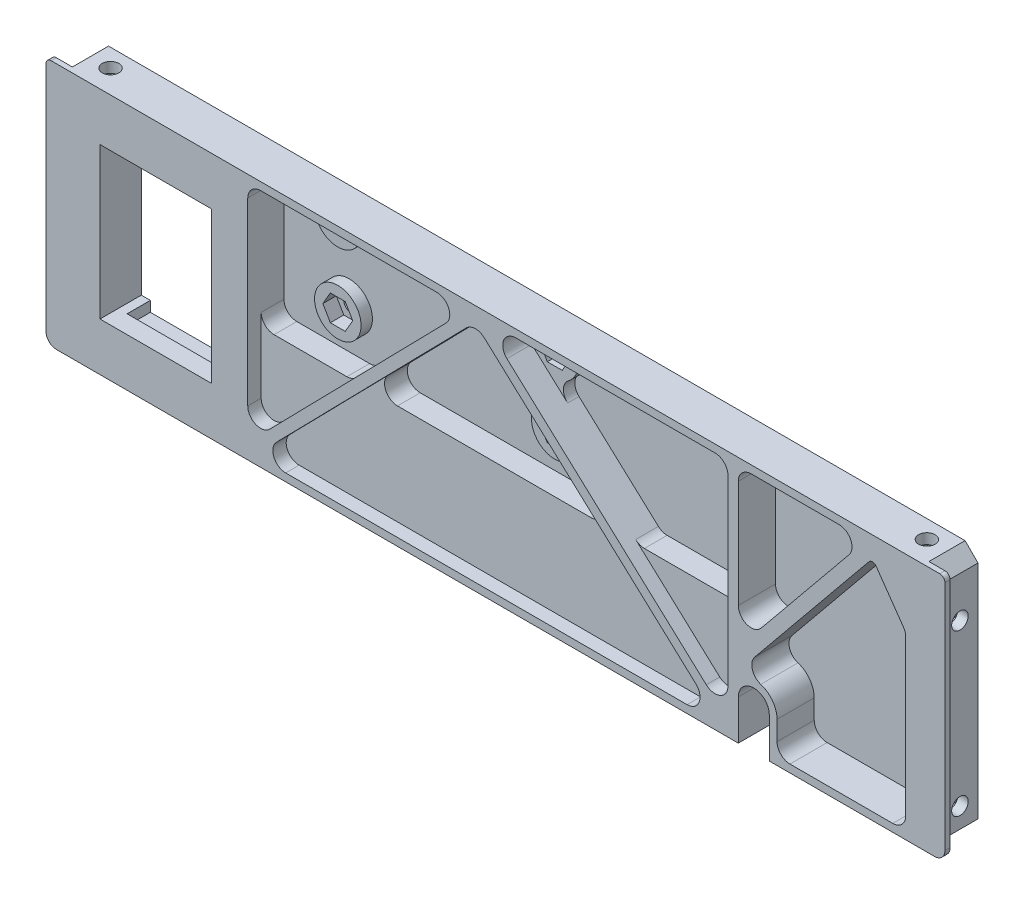
from build123d import *

# Parameters (mm, degrees)
SKETCH1_W                 = 174
SKETCH1_H                 = 51.1
BOSS_EXTRUDE1_DEPTH       = 8
SKETCH2_OUTSIDE_W         = 212.304
SKETCH2_OUTSIDE_H         = 89.404
SKETCH2_OUTSIDE_W_2       = 170.8
SKETCH2_OUTSIDE_H_2       = 47.9
CUT_EXTRUDE1_DEPTH        = 7
CHAMFER1_SIZE             = 2.5
FILLET1_R                 = 0.5
SKETCH3_W                 = 158.8
SKETCH3_H                 = 44.9
CUT_EXTRUDE2_DEPTH        = 7.2
BOSS_EXTRUDE2_DEPTH       = 7.2
F_3_0MM_DOWEL_HOLE1_D     = 3.2
F_3_0MM_DOWEL_HOLE1_DEPTH = 5
F_3_0MM_DOWEL_HOLE2_D     = 3.2
F_3_0MM_DOWEL_HOLE2_DEPTH = 5
CUT_EXTRUDE3_START        = -2
SKETCH10_W                = 6.25
SKETCH10_H                = 5.5
CUT_EXTRUDE3_DEPTH        = 1.8
CUT_EXTRUDE4_START        = -2
SKETCH11_W                = 5.5
SKETCH11_H                = 6.25
CUT_EXTRUDE4_DEPTH        = 1.8
BOSS_EXTRUDE3_DEPTH       = 7.2
SMALL_FIX_DEPTH           = 7.2
SKETCH14_W                = 174
SKETCH14_H                = 1.6
CUT_EXTRUDE5_DEPTH        = 91.94395252
FILLET2_R                 = 2.5
FILLET3_R                 = 1
FILLET4_R                 = 2
SKETCH23_W                = 174
SKETCH23_H                = 1.6
CUT_EXTRUDE9_DEPTH        = 91.94395252
BOSS_EXTRUDE7_START       = -7.2
BOSS_EXTRUDE7_DEPTH       = 7.2
SKETCH26_W                = 21.6
SKETCH26_H                = 29.25
CUT_EXTRUDE10_DEPTH       = 8
FILLET5_R                 = 1
CUT_EXTRUDE15_DEPTH       = 91.52316002
CUT_EXTRUDE15_DEPTH_BACK  = 91.52316002
BOSS_EXTRUDE12_DEPTH      = 7.2
SKETCH38_W                = 96.95
SKETCH38_H                = 46.4
BOSS_EXTRUDE13_DEPTH      = 8
SKETCH40_W                = 33
SKETCH40_H                = 18.02
SKETCH40_W_2              = 43.4
SKETCH40_H_2              = 17.6
CUT_EXTRUDE16_DEPTH       = 2
SKETCH42_W                = 7
SKETCH42_H                = 17.6
SKETCH42_W_2              = 28.4
CUT_EXTRUDE17_DEPTH       = 2.4
SKETCH43_W                = 92.95
SKETCH43_H                = 44.9
CUT_EXTRUDE18_DEPTH       = 2.6
SKETCH44_W                = 92.95
SKETCH44_H                = 25.45
CUT_EXTRUDE19_DEPTH       = 4.4
SKETCH45_R                = 1.45
CUT_EXTRUDE20_DEPTH       = 91.590300253
SKETCH46_R                = 4.5
SKETCH46_R_2              = 1.45
BOSS_EXTRUDE14_DEPTH      = 2.2
CUT_EXTRUDE21_DEPTH       = 2.6
BOSS_EXTRUDE15_REACH      = 92.59
BOSS_EXTRUDE16_START      = -2.2
BOSS_EXTRUDE16_DEPTH      = 2.2
FILLET6_R                 = 2.5
SKETCH50_W                = 18.1
SKETCH50_H                = 2
CUT_EXTRUDE22_DEPTH       = 4.5


with BuildPart() as part:
    # Sketch1 → Boss-Extrude1 (new body)
    with BuildSketch(Plane.XY):
        Rectangle(SKETCH1_W, SKETCH1_H)
    extrude(amount=-BOSS_EXTRUDE1_DEPTH)

    # Sketch2 outside → Cut-Extrude1 (cut)
    with BuildSketch(Plane(origin=(0, 0, -8), x_dir=(-1, 0, 0), z_dir=(0, 0, -1))):
        Rectangle(SKETCH2_OUTSIDE_W, SKETCH2_OUTSIDE_H)
        Rectangle(SKETCH2_OUTSIDE_W_2, SKETCH2_OUTSIDE_H_2, mode=Mode.SUBTRACT)
    extrude(amount=-CUT_EXTRUDE1_DEPTH, mode=Mode.SUBTRACT)

    # Chamfer1
    chamfer1_edges = [part.edges().sort_by_distance(p)[0] for p in [
        (85.4, -23.95, -4.5),
        (85.4, 23.95, -4.5),
        (-85.4, 23.95, -4.5),
        (-85.4, -23.95, -4.5),
    ]]
    chamfer(chamfer1_edges, length=CHAMFER1_SIZE)

    # Fillet1
    fillet1_edges = [part.edges().sort_by_distance(p)[0] for p in [
        (87, 25.55, -0.5),
        (-87, 25.55, -0.5),
    ]]
    fillet(fillet1_edges, radius=FILLET1_R)

    # Sketch3 → Cut-Extrude2 (cut)
    with BuildSketch(Plane.XY):
        Rectangle(SKETCH3_W, SKETCH3_H)
    extrude(amount=-CUT_EXTRUDE2_DEPTH, mode=Mode.SUBTRACT)

    # Sketch9 → Boss-Extrude2 (add)
    with BuildSketch(Plane.XY):
        Polygon((-73.4, 22.45), (-73.4, 19.45), (-79.4, 10.88111196), (-79.4, 22.45), align=None)
    boss_extrude2 = extrude(amount=-BOSS_EXTRUDE2_DEPTH)

    # Ø3.0mm Dowel Hole1
    with Locations(Plane.ZY.offset(85.4)):
        with Locations((-4.5, 13.55), (-4.5, -17.55)):
            f_3_0mm_dowel_hole1 = Hole(F_3_0MM_DOWEL_HOLE1_D / 2, depth=F_3_0MM_DOWEL_HOLE1_DEPTH)

    # Ø3.0mm Dowel Hole2
    with Locations(Plane(origin=(0, 23.95, 0), x_dir=(1, 0, 0), z_dir=(0, 1, 0))):
        with Locations((-79, 4.5)):
            f_3_0mm_dowel_hole2 = Hole(F_3_0MM_DOWEL_HOLE2_D / 2, depth=F_3_0MM_DOWEL_HOLE2_DEPTH)

    # Sketch10 → Cut-Extrude3 (cut)
    with BuildSketch(Plane.ZY.offset(85.4).offset(CUT_EXTRUDE3_START)):
        with Locations((-4.875, 13.55)):
            Rectangle(SKETCH10_W, SKETCH10_H)
        with Locations((-4.875, -17.55)):
            Rectangle(SKETCH10_W, SKETCH10_H)
    cut_extrude3 = extrude(amount=-CUT_EXTRUDE3_DEPTH, mode=Mode.SUBTRACT)

    # Sketch11 → Cut-Extrude4 (cut)
    with BuildSketch(Plane(origin=(0, 23.95, 0), x_dir=(1, 0, 0), z_dir=(0, 1, 0)).offset(CUT_EXTRUDE4_START)):
        with Locations((-79, 4.875)):
            Rectangle(SKETCH11_W, SKETCH11_H)
    cut_extrude4 = extrude(amount=-CUT_EXTRUDE4_DEPTH, mode=Mode.SUBTRACT)

    # Mirror1: Boss-Extrude2, Ø3.0mm Dowel Hole1, Ø3.0mm Dowel Hole2, Cut-Extrude3, Cut-Extrude4 across plane
    add(boss_extrude2.mirror(Plane(origin=(0, 0, 0), x_dir=(0, 0, 1), z_dir=(1, 0, 0))))
    add(f_3_0mm_dowel_hole1.mirror(Plane(origin=(0, 0, 0), x_dir=(0, 0, 1), z_dir=(1, 0, 0))), mode=Mode.SUBTRACT)
    add(f_3_0mm_dowel_hole2.mirror(Plane(origin=(0, 0, 0), x_dir=(0, 0, 1), z_dir=(1, 0, 0))), mode=Mode.SUBTRACT)
    add(cut_extrude3.mirror(Plane(origin=(0, 0, 0), x_dir=(0, 0, 1), z_dir=(1, 0, 0))), mode=Mode.SUBTRACT)
    add(cut_extrude4.mirror(Plane(origin=(0, 0, 0), x_dir=(0, 0, 1), z_dir=(1, 0, 0))), mode=Mode.SUBTRACT)

    # Sketch12 → Boss-Extrude3 (add)
    with BuildSketch(Plane.XY.offset(-7.2)):
        with BuildLine():
            Line((-74.367830663, 21.658922376), (-37.47426453, -23.477892866))
            ThreePointArc((-37.47426453, -23.477892866), (-36.7, -23.845030766), (-35.92573547, -23.477892866))
            Line((-35.92573547, -23.477892866), (0, 20.474846169))
            Line((0, 20.474846169), (35.92573547, -23.477892866))
            ThreePointArc((35.92573547, -23.477892866), (36.7, -23.845030766), (37.47426453, -23.477892866))
            Line((37.47426453, -23.477892866), (74.367830663, 21.658922376))
            ThreePointArc((74.367830663, 21.658922376), (74.191077624, 23.417830663), (72.432169337, 23.241077624))
            Line((72.432169337, 23.241077624), (36.7, -20.474846169))
            Line((36.7, -20.474846169), (0.77426453, 23.477892866))
            ThreePointArc((0.77426453, 23.477892866), (0, 23.845030766), (-0.77426453, 23.477892866))
            Line((-0.77426453, 23.477892866), (-36.7, -20.474846169))
            Line((-36.7, -20.474846169), (-72.432169337, 23.241077624))
            ThreePointArc((-72.432169337, 23.241077624), (-74.191077624, 23.417830663), (-74.367830663, 21.658922376))
        make_face()
    extrude(amount=BOSS_EXTRUDE3_DEPTH)

    # Sketch13 → Small Fix (add)
    with BuildSketch(Plane.XY):
        Polygon((-73.4, 19.45), (-73.4, 20.474846169), (-72.562319501, 19.45), align=None)
        Polygon((72.562319501, 19.45), (73.4, 19.45), (73.4, 20.474846169), align=None)
    extrude(amount=-SMALL_FIX_DEPTH)

    # Sketch14 → Cut-Extrude5 (cut, through all)
    with BuildSketch(Plane(origin=(0, 0, -1), x_dir=(-1, 0, 0), z_dir=(0, 0, -1))):
        with Locations((0, -24.75)):
            Rectangle(SKETCH14_W, SKETCH14_H)
    extrude(amount=-CUT_EXTRUDE5_DEPTH, mode=Mode.SUBTRACT)

    # Fillet2
    fillet2_edges = [part.edges().sort_by_distance(p)[0] for p in [
        (-79.4, 10.88111196, -3.6),
        (79.4, 10.88111196, -3.6),
        (35.085564686, -22.45, -3.6),
        (-35.085564686, -22.45, -3.6),
        (71.785564686, 22.45, -3.6),
        (1.614435314, 22.45, -3.6),
        (36.7, -20.474846169, -3.6),
        (-1.614435314, 22.45, -3.6),
        (-71.785564686, 22.45, -3.6),
        (-36.7, -20.474846169, -3.6),
        (0, 20.474846169, -3.6),
        (-38.314435314, -22.45, -3.6),
        (38.314435314, -22.45, -3.6),
        (-79.4, -22.45, -3.6),
        (79.4, -22.45, -3.6),
    ]]
    fillet(fillet2_edges, radius=FILLET2_R)

    # Fillet3
    # the kernel refuses this fillet: 1 mm, written as the material it adds along each edge
    with BuildSketch(Plane(origin=(73.4, 19.45, 0), x_dir=(-1, 0, 0), z_dir=(0, 0, -1))) as fillet3_piece_1_section:
        with BuildLine():
            CenterArc((FILLET3_R * 0.520567050552, -FILLET3_R), FILLET3_R, 90, 55)
            Line((-FILLET3_R * 0.298584993737, -FILLET3_R * 0.426423563649), (0, 0))
            Line((0, 0), (FILLET3_R * 0.520567050552, 0))
        make_face()
    fillet3_piece_1 = extrude(amount=8.501417626, mode=Mode.PRIVATE)
    fillet3_piece_1 = split(fillet3_piece_1, bisect_by=Plane(origin=(73.353785403, 19.361222585, -8), z_dir=(0, 0, 1)), keep=Keep.TOP, mode=Mode.PRIVATE)
    add(fillet3_piece_1)
    with BuildSketch(Plane(origin=(72.562319501, 19.45, 0), x_dir=(-0.6328620994689726, -0.7742645304130392, 0), z_dir=(0, 0, -1))) as fillet3_piece_2_section:
        with BuildLine():
            CenterArc((FILLET3_R * 0.474176313275, -FILLET3_R), FILLET3_R, 90, 50.738399871)
            Line((-FILLET3_R * 0.300088217138, -FILLET3_R * 0.367137900531), (0, 0))
            Line((0, 0), (FILLET3_R * 0.474176313275, 0))
        make_face()
    fillet3_piece_2 = extrude(amount=8.385440783, mode=Mode.PRIVATE)
    fillet3_piece_2 = split(fillet3_piece_2, bisect_by=Plane(origin=(72.598343981, 19.374027247, -8), z_dir=(0, 0, 1)), keep=Keep.TOP, mode=Mode.PRIVATE)
    add(fillet3_piece_2)
    with BuildSketch(Plane(origin=(-72.562319501, 19.45, 0), x_dir=(0.6328620994689873, -0.7742645304130272, 0), z_dir=(0, 0, -1))) as fillet3_piece_3:
        with BuildLine():
            CenterArc((FILLET3_R * 0.474176313275, FILLET3_R), FILLET3_R, 219.261600129, 50.738399871)
            Line((-FILLET3_R * 0.300088217138, FILLET3_R * 0.367137900531), (0, 0))
            Line((0, 0), (FILLET3_R * 0.474176313275, 0))
        make_face()
    extrude(amount=7.2)
    with BuildSketch(Plane(origin=(-73.4, 19.45, 0), x_dir=(1, 0, 0), z_dir=(0, 0, -1))) as fillet3_piece_4:
        with BuildLine():
            CenterArc((FILLET3_R * 0.520567050552, FILLET3_R), FILLET3_R, 215, 55)
            Line((-FILLET3_R * 0.298584993737, FILLET3_R * 0.426423563649), (0, 0))
            Line((0, 0), (FILLET3_R * 0.520567050552, 0))
        make_face()
    extrude(amount=7.2)

    # Fillet4
    fillet4_edges = [part.edges().sort_by_distance(p)[0] for p in [
        (87, -23.95, -0.5),
        (-87, -23.95, -0.5),
    ]]
    fillet(fillet4_edges, radius=FILLET4_R)

    # Sketch23 → Cut-Extrude9 (cut, through all)
    with BuildSketch(Plane(origin=(0, 0, -1), x_dir=(-1, 0, 0), z_dir=(0, 0, -1))):
        with Locations((0, 24.75)):
            Rectangle(SKETCH23_W, SKETCH23_H)
    extrude(amount=-CUT_EXTRUDE9_DEPTH, mode=Mode.SUBTRACT)

    # Sketch24 → Boss-Extrude7 (add)
    with BuildSketch(Plane.XY.offset(BOSS_EXTRUDE7_START)):
        with BuildLine():
            Line((-73.698584994, 19.023576436), (-73.698584994, 22.45))
            Line((-73.698584994, 22.45), (-49.95, 22.45))
            Line((-49.95, 22.45), (-49.95, -22.45))
            Line((-49.95, -22.45), (-79.4, -22.45))
            Line((-79.4, -22.45), (-79.4, 10.092864987))
            ThreePointArc((-79.4, 10.092864987), (-79.284292377, 10.844629486), (-78.947880111, 11.526806078))
            Line((-78.947880111, 11.526806078), (-73.698584994, 19.023576436))
        make_face()
    extrude(amount=BOSS_EXTRUDE7_DEPTH)

    # Sketch26 → Cut-Extrude10 (cut)
    with BuildSketch(Plane.XY):
        with Locations((-65.75, 0)):
            Rectangle(SKETCH26_W, SKETCH26_H)
    extrude(amount=-CUT_EXTRUDE10_DEPTH, mode=Mode.SUBTRACT)

    # Fillet5
    fillet5_edges = [part.edges().sort_by_distance(p)[0] for p in [
        (87, 23.95, -0.5),
        (-87, 23.95, -0.5),
    ]]
    fillet(fillet5_edges, radius=FILLET5_R)

    # Sketch35 → Cut-Extrude15 (cut, two sides: drawn at the far end of the back side and taken through both)
    with BuildSketch(Plane.XY.offset(-7.2).offset(-CUT_EXTRUDE15_DEPTH_BACK)):
        with BuildLine():
            Line((47, -16.2), (47, -23.95))
            Line((47, -23.95), (53, -23.95))
            Line((53, -23.95), (53, -16.2))
            ThreePointArc((53, -16.2), (50, -13.2), (47, -16.2))
        make_face()
    extrude(amount=CUT_EXTRUDE15_DEPTH + CUT_EXTRUDE15_DEPTH_BACK, mode=Mode.SUBTRACT)

    # Sketch37 → Boss-Extrude12 (add)
    with BuildSketch(Plane.XY):
        with BuildLine():
            Line((47, -16.2), (47, -22.45))
            Line((47, -22.45), (43.586735785, -22.45))
            ThreePointArc((43.586735785, -22.45), (41.327821431, -21.021123681), (41.651074459, -18.367844751))
            Line((41.651074459, -18.367844751), (47.101183643, -11.7))
            Line((47.101183643, -11.7), (50, -11.7))
            ThreePointArc((50, -11.7), (53.181980515, -13.018019485), (54.5, -16.2))
            Line((54.5, -16.2), (54.5, -22.45))
            Line((54.5, -22.45), (53, -22.45))
            Line((53, -22.45), (53, -16.2))
            ThreePointArc((53, -16.2), (50, -13.2), (47, -16.2))
        make_face()
    extrude(amount=-BOSS_EXTRUDE12_DEPTH)

    # Sketch38 → Boss-Extrude13 (add)
    with BuildSketch(Plane.XY):
        with Locations((-1.475, -0.75)):
            Rectangle(SKETCH38_W, SKETCH38_H)
    extrude(amount=-BOSS_EXTRUDE13_DEPTH)

    # Sketch40 → Cut-Extrude16 (cut)
    with BuildSketch(Plane(origin=(0, 0, -8), x_dir=(-1, 0, 0), z_dir=(0, 0, -1))):
        with Locations((-19, -14.01)):
            Rectangle(SKETCH40_W, SKETCH40_H)
        with Locations((29.4, -13.8)):
            Rectangle(SKETCH40_W_2, SKETCH40_H_2)
    extrude(amount=-CUT_EXTRUDE16_DEPTH, mode=Mode.SUBTRACT)

    # Sketch42 → Cut-Extrude17 (cut)
    with BuildSketch(Plane(origin=(0, 0, -6), x_dir=(-1, 0, 0), z_dir=(0, 0, -1))):
        with Locations((11.2, -13.8)):
            Rectangle(SKETCH42_W, SKETCH42_H)
        with Locations((33.9, -13.8)):
            Rectangle(SKETCH42_W_2, SKETCH42_H)
    extrude(amount=-CUT_EXTRUDE17_DEPTH, mode=Mode.SUBTRACT)

    # Sketch43 → Cut-Extrude18 (cut)
    with BuildSketch(Plane.XY):
        with Locations((-1.475, 0)):
            Rectangle(SKETCH43_W, SKETCH43_H)
    extrude(amount=-CUT_EXTRUDE18_DEPTH, mode=Mode.SUBTRACT)

    # Sketch44 → Cut-Extrude19 (cut)
    with BuildSketch(Plane.XY.offset(-2.6)):
        with Locations((-1.475, 9.725)):
            Rectangle(SKETCH44_W, SKETCH44_H)
    extrude(amount=-CUT_EXTRUDE19_DEPTH, mode=Mode.SUBTRACT)

    # Sketch45 → Cut-Extrude20 (cut, through all)
    with BuildSketch(Plane(origin=(0, 0, -8), x_dir=(-1, 0, 0), z_dir=(0, 0, -1))):
        with Locations((-6.68, 19.2)):
            Circle(SKETCH45_R)
        with Locations((-6.68, 5.6)):
            Circle(SKETCH45_R)
        with Locations((35.32, 20.16)):
            Circle(SKETCH45_R)
        with Locations((35.32, 4.74)):
            Circle(SKETCH45_R)
    extrude(amount=-CUT_EXTRUDE20_DEPTH, mode=Mode.SUBTRACT)

    # Sketch46 → Boss-Extrude14 (add)
    # profile 1 of 4: a face of its own
    with BuildSketch(Plane.XY.offset(-7)):
        with Locations((-35.32, 4.74)):
            Circle(SKETCH46_R)
        with Locations(Location((-35.32, 4.74, 0), (0, 0, 180))):
            Circle(SKETCH46_R_2, mode=Mode.SUBTRACT)
    # profile 2 of 4: a face of its own
    with BuildSketch(Plane.XY.offset(-7)):
        with Locations((6.68, 5.6)):
            Circle(SKETCH46_R)
        with Locations(Location((6.68, 5.6, 0), (0, 0, 180))):
            Circle(SKETCH46_R_2, mode=Mode.SUBTRACT)
    # profile 3 of 4: a face of its own
    with BuildSketch(Plane.XY.offset(-7)):
        with BuildLine():
            Line((-30.82, 23.95), (-30.82, 20.16))
            ThreePointArc((-30.82, 20.16), (-35.32, 15.66), (-39.82, 20.16))
            Line((-39.82, 20.16), (-39.82, 23.95))
            Line((-39.82, 23.95), (-30.82, 23.95))
        make_face()
        with Locations(Location((-35.32, 20.16, 0), (0, 0, 180))):
            Circle(SKETCH46_R_2, mode=Mode.SUBTRACT)
    # profile 4 of 4: a face of its own
    with BuildSketch(Plane.XY.offset(-7)):
        with BuildLine():
            Line((2.18, 23.95), (11.18, 23.95))
            Line((11.18, 23.95), (11.18, 19.2))
            ThreePointArc((11.18, 19.2), (6.68, 14.7), (2.18, 19.2))
            Line((2.18, 19.2), (2.18, 23.95))
        make_face()
        with Locations(Location((6.68, 19.2, 0), (0, 0, 180))):
            Circle(SKETCH46_R_2, mode=Mode.SUBTRACT)
    extrude(amount=BOSS_EXTRUDE14_DEPTH)

    # Sketch47 → Cut-Extrude21 (cut)
    with BuildSketch(Plane.XY.offset(-4.8)):
        Polygon((-32.433248654, 20.16), (-33.876624327, 22.66), (-36.763375673, 22.66), (-38.206751346, 20.16), (-36.763375673, 17.66), (-33.876624327, 17.66), align=None)
        Polygon((-32.433248654, 4.74), (-33.876624327, 7.24), (-36.763375673, 7.24), (-38.206751346, 4.74), (-36.763375673, 2.24), (-33.876624327, 2.24), align=None)
        Polygon((9.566751346, 5.6), (8.123375673, 8.1), (5.236624327, 8.1), (3.793248654, 5.6), (5.236624327, 3.1), (8.123375673, 3.1), align=None)
        Polygon((3.793248654, 19.2), (5.236624327, 16.7), (8.123375673, 16.7), (9.566751346, 19.2), (8.123375673, 21.7), (5.236624327, 21.7), align=None)
    extrude(amount=-CUT_EXTRUDE21_DEPTH, mode=Mode.SUBTRACT)

    # Sketch48 → Boss-Extrude15 (add, up to next)
    with BuildSketch(Plane.XY, mode=Mode.PRIVATE) as boss_extrude15_sk1:
        Polygon((-47.235373555, -23.149506286), (-3.962206737, 21.059030463), (44.324411653, -23.187279042), (45.675588347, -21.712720958), (-4.037793263, 23.840969537), (-48.664626445, -21.750493714), align=None)
    boss_extrude15_tool1 = extrude(boss_extrude15_sk1.sketch, amount=-BOSS_EXTRUDE15_REACH, mode=Mode.PRIVATE) - part.part
    add(boss_extrude15_tool1.solids().sort_by_distance((-26.352094, -0.307873, 0))[0])

    # Sketch49 → Boss-Extrude16 (add)
    with BuildSketch(Plane.XY.offset(-4.8).offset(BOSS_EXTRUDE16_START)):
        with BuildLine():
            Line((-2.51980869, 22.45), (2.18, 22.45))
            Line((2.18, 22.45), (2.18, 19.2))
            ThreePointArc((2.18, 19.2), (2.221475714, 18.590441807), (2.345138307, 17.992119997))
            Line((2.345138307, 17.992119997), (-2.51980869, 22.45))
        make_face()
    extrude(amount=BOSS_EXTRUDE16_DEPTH)

    # Fillet6
    # the kernel refuses this fillet: 2.5 mm, written as the material it adds along each edge
    with BuildSketch(Plane(origin=(47, 22.45, 0), x_dir=(1, 0, 0), z_dir=(0, 0, -1)), Plane(origin=(54.5, -22.45, 0), x_dir=(0, 1, 0), z_dir=(0, 0, -1))) as fillet6_piece_1:
        with BuildLine():
            CenterArc((FILLET6_R, FILLET6_R), FILLET6_R, 180, 90)
            Line((0, FILLET6_R), (0, 0))
            Line((0, 0), (FILLET6_R, 0))
        make_face()
    extrude(amount=7.2)
    with BuildSketch(Plane(origin=(47, -7.873483772, 0), x_dir=(0, 1, 0), z_dir=(0, 0, -1))) as fillet6_piece_2:
        with BuildLine():
            CenterArc((FILLET6_R * 2.80355630698, FILLET6_R), FILLET6_R, 129.261600129, 140.738399871)
            Line((FILLET6_R * 2.17069420751, FILLET6_R * 1.77426453041), (0, 0))
            Line((0, 0), (FILLET6_R * 2.80355630698, 0))
        make_face()
    extrude(amount=7.2)
    with BuildSketch(Plane(origin=(47.101183643, -11.7, 0), x_dir=(0.6328620994689939, 0.7742645304130218, 0), z_dir=(0, 0, -1))) as fillet6_piece_3:
        with BuildLine():
            CenterArc((4.852654405, 2.5), FILLET6_R, 158.263851924, 111.736148076)
            Line((2.530406624, 3.42583219), (2.298181846, 3.518415409))
            ThreePointArc((2.298181846, 3.518415409), (1.640984873, 2.40266621), (-0.193566133, 0.158215525))
            Line((-0.193566133, 0.158215525), (0, -0.25))
            Line((0, -0.25), (4.852654405, -0.25))
            Line((4.852654405, -0.25), (4.852654405, 0))
        make_face()
    extrude(amount=7.2)
    with BuildSketch(Plane(origin=(-47.95, -21.020420281, -2.6), x_dir=(0, 1, 0), z_dir=(0, 0, 1))) as fillet6_piece_4:
        with BuildLine():
            CenterArc((FILLET6_R * 2.4511951911, -FILLET6_R), FILLET6_R, 90, 135.61259332)
            Line((FILLET6_R * 1.75168890493, -FILLET6_R * 1.7146264448), (0, 0))
            Line((0, 0), (FILLET6_R * 2.4511951911, 0))
        make_face()
    extrude(amount=2.6)
    with BuildSketch(Plane(origin=(-46.550667513, -22.45, 0), x_dir=(0.699506286169578, 0.7146264448012293, 0), z_dir=(0, 0, -1))) as fillet6_piece_5:
        with BuildLine():
            CenterArc((FILLET6_R * 2.37817435743, FILLET6_R), FILLET6_R, 135.61259332, 134.38740668)
            Line((FILLET6_R * 1.66354791263, FILLET6_R * 1.69950628617), (0, 0))
            Line((0, 0), (FILLET6_R * 2.37817435743, 0))
        make_face()
    extrude(amount=2.6)
    with BuildSketch(Plane(origin=(43.51980869, -22.45, -2.6), x_dir=(-0.7372790420367393, 0.6755883466826437, 0), z_dir=(0, 0, 1))) as fillet6_piece_6:
        with BuildLine():
            CenterArc((FILLET6_R * 2.57150534133, FILLET6_R), FILLET6_R, 132.499855382, 137.500144618)
            Line((FILLET6_R * 1.89591699465, FILLET6_R * 1.73727904204), (0, 0))
            Line((0, 0), (FILLET6_R * 2.57150534133, 0))
        make_face()
    extrude(amount=2.6)
    with BuildSketch(Plane(origin=(45, -21.093661432, 0), x_dir=(-0.7372790420367379, 0.6755883466826454, 0), z_dir=(0, 0, -1))) as fillet6_piece_7:
        with BuildLine():
            CenterArc((FILLET6_R * 2.27266509849, FILLET6_R), FILLET6_R, 137.500144618, 132.499855382)
            Line((FILLET6_R * 1.53538605645, FILLET6_R * 1.67558834668), (0, 0))
            Line((0, 0), (FILLET6_R * 2.27266509849, 0))
        make_face()
    extrude(amount=2.6)
    with BuildSketch(Plane(origin=(45, 22.45, -7), x_dir=(0, -1, 0), z_dir=(0, 0, 1)), Plane(origin=(-47.95, 22.45, 0), x_dir=(0, -1, 0), z_dir=(0, 0, -1))) as fillet6_piece_8:
        with BuildLine():
            CenterArc((FILLET6_R, -FILLET6_R), FILLET6_R, 90, 90)
            Line((0, -FILLET6_R), (0, 0))
            Line((0, 0), (FILLET6_R, 0))
        make_face()
    extrude(amount=7)
    with BuildSketch(Plane(origin=(25.254133404, -3, -2.6), x_dir=(1, 0, 0), z_dir=(0, 0, -1))) as fillet6_piece_9:
        with BuildLine():
            CenterArc((FILLET6_R * 0.388877278972, -FILLET6_R), FILLET6_R, 90, 42.499855382)
            Line((-FILLET6_R * 0.28671106771, -FILLET6_R * 0.262720957963), (0, 0))
            Line((0, 0), (FILLET6_R * 0.388877278972, 0))
        make_face()
    extrude(amount=4.4)
    with BuildSketch(Plane(origin=(45, -3, -2.6), x_dir=(-1, 0, 0), z_dir=(0, 0, -1))) as fillet6_piece_10:
        with BuildLine():
            CenterArc((FILLET6_R, FILLET6_R), FILLET6_R, 180, 90)
            Line((0, FILLET6_R), (0, 0))
            Line((0, 0), (FILLET6_R, 0))
        make_face()
    extrude(amount=4.4)
    with BuildSketch(Plane(origin=(22.293750783, -3, -7), x_dir=(-1, 0, 0), z_dir=(0, 0, 1))) as fillet6_piece_11:
        with BuildLine():
            CenterArc((FILLET6_R * 2.57150534133, -FILLET6_R), FILLET6_R, 90, 137.500144618)
            Line((FILLET6_R * 1.89591699465, -FILLET6_R * 1.73727904204), (0, 0))
            Line((0, 0), (FILLET6_R * 2.57150534133, 0))
        make_face()
    extrude(amount=4.4)
    with BuildSketch(Plane(origin=(-27.512193126, -3, -2.6), x_dir=(1, 0, 0), z_dir=(0, 0, -1))) as fillet6_piece_12:
        with BuildLine():
            CenterArc((FILLET6_R * 2.37817435743, -FILLET6_R), FILLET6_R, 90, 134.38740668)
            Line((FILLET6_R * 1.66354791263, -FILLET6_R * 1.69950628617), (0, 0))
            Line((0, 0), (FILLET6_R * 2.37817435743, 0))
        make_face()
    extrude(amount=4.4)
    with BuildSketch(Plane(origin=(-47.95, -3, -2.6), x_dir=(1, 0, 0), z_dir=(0, 0, -1))) as fillet6_piece_13:
        with BuildLine():
            CenterArc((FILLET6_R, -FILLET6_R), FILLET6_R, 90, 90)
            Line((0, -FILLET6_R), (0, 0))
            Line((0, 0), (FILLET6_R, 0))
        make_face()
    extrude(amount=4.4)
    with BuildSketch(Plane(origin=(-30.310858099, -3, -7), x_dir=(-1, 0, 0), z_dir=(0, 0, 1))) as fillet6_piece_14:
        with BuildLine():
            CenterArc((FILLET6_R * 0.420490615785, -FILLET6_R), FILLET6_R, 90, 45.61259332)
            Line((-FILLET6_R * 0.294135829017, -FILLET6_R * 0.30049371383), (0, 0))
            Line((0, 0), (FILLET6_R * 0.420490615785, 0))
        make_face()
    extrude(amount=4.4)
    with BuildSketch(Plane(origin=(-39.82, 22.45, -7), x_dir=(0.0008352392262400111, -0.9999996511876567, 0), z_dir=(0, 0, 1)), Plane(origin=(-30.82, 22.45, -4.8), x_dir=(-0.0008352392262458712, -0.9999996511876567, 0), z_dir=(0, 0, -1))) as fillet6_piece_15:
        with BuildLine():
            CenterArc((2.497913661, -2.498936518), FILLET6_R, 91.671275633, 88.280868679)
            Line((-0.002085466, -2.49684842), (-0.252085379, -2.49663961))
            Line((-0.252085379, -2.49663961), (-0.249999913, 0.00020881))
            Line((-0.249999913, 0.00020881), (0.00020881, 0.249999913))
            ThreePointArc((0.00020881, 0.249999913), (2.290208011, 0.248087215), (2.417709564, 0.249893652))
            Line((2.417709564, 0.249893652), (2.425000846, 0))
        make_face()
    extrude(amount=2.2)
    with BuildSketch(Plane(origin=(-5.399332487, 22.45, 0), x_dir=(-0.6995062861695777, -0.7146264448012296, 0), z_dir=(0, 0, -1))) as fillet6_piece_16:
        with BuildLine():
            CenterArc((FILLET6_R * 2.37817435743, FILLET6_R), FILLET6_R, 135.61259332, 134.38740668)
            Line((FILLET6_R * 1.66354791263, FILLET6_R * 1.69950628617), (0, 0))
            Line((0, 0), (FILLET6_R * 2.37817435743, 0))
        make_face()
    extrude(amount=7)
    with BuildSketch(Plane(origin=(-3.962206737, 21.059030463, 0), x_dir=(0.7372790420367389, -0.6755883466826443, 0), z_dir=(0, 0, -1))) as fillet6_piece_17:
        with BuildLine():
            CenterArc((FILLET6_R * 0.96758699034, FILLET6_R), FILLET6_R, 181.887551298, 88.112448702)
            Line((-FILLET6_R * 0.0318704056646, FILLET6_R * 0.967061973773), (0, 0))
            Line((0, 0), (FILLET6_R * 0.96758699034, 0))
        make_face()
    extrude(amount=7)
    with BuildSketch(Plane(origin=(5.854546767, 14.776355919, -4.8), x_dir=(0.9742361103344191, 0.2255304886716236, 0), z_dir=(0, 0, -1))) as fillet6_piece_18:
        with BuildLine():
            CenterArc((4.604735339, 2.290838296), FILLET6_R, 145.533930139, 100.862147216)
            Line((2.543581675, 3.705633536), (0, 0))
            ThreePointArc((0, 0), (1.801852959, 0.376491068), (3.603705918, 0))
        make_face()
    extrude(amount=2.2)
    with BuildSketch(Plane(origin=(-2.51980869, 22.45, -4.8), x_dir=(0.7372790420367388, -0.6755883466826442, 0), z_dir=(0, 0, 1))) as fillet6_piece_19:
        with BuildLine():
            CenterArc((FILLET6_R * 2.57150534133, FILLET6_R), FILLET6_R, 132.499855382, 137.500144618)
            Line((FILLET6_R * 1.89591699465, FILLET6_R * 1.73727904204), (0, 0))
            Line((0, 0), (FILLET6_R * 2.57150534133, 0))
        make_face()
    extrude(amount=4.8)
    with BuildSketch(Plane(origin=(8.346868505, 9.779898251, -4.8), x_dir=(-0.994847776015874, -0.10137999090683184, 0), z_dir=(0, 0, -1))) as fillet6_piece_20:
        with BuildLine():
            CenterArc((5.320764984, 2.216319647), FILLET6_R, 138.318497407, 104.121633107)
            Line((3.453632717, 3.878792834), (0, 0))
            ThreePointArc((0, 0), (2.082038472, 0.510624635), (4.164076944, 0))
        make_face()
    extrude(amount=2.2)
    with BuildSketch(Plane(origin=(10.698705092, 7.624847991, -4.8), x_dir=(-0.0142824649932616, -0.9998980003948983, 0), z_dir=(0, 0, -1))) as fillet6_piece_21:
        with BuildLine():
            CenterArc((5.320764984, -2.216319647), FILLET6_R, 117.559869486, 104.121633107)
            Line((3.453632717, -3.878792834), (0, 0))
            ThreePointArc((0, 0), (2.082038472, -0.510624635), (4.164076944, 0))
        make_face()
    extrude(amount=2.2)

    # Sketch50 → Cut-Extrude22 (cut)
    with BuildSketch(Plane(origin=(0, 0, -8), x_dir=(-1, 0, 0), z_dir=(0, 0, -1))):
        with Locations((65.75, 15.625)):
            Rectangle(SKETCH50_W, SKETCH50_H)
        with Locations((65.75, -15.625)):
            Rectangle(SKETCH50_W, SKETCH50_H)
    extrude(amount=-CUT_EXTRUDE22_DEPTH, mode=Mode.SUBTRACT)


solid = part.part
